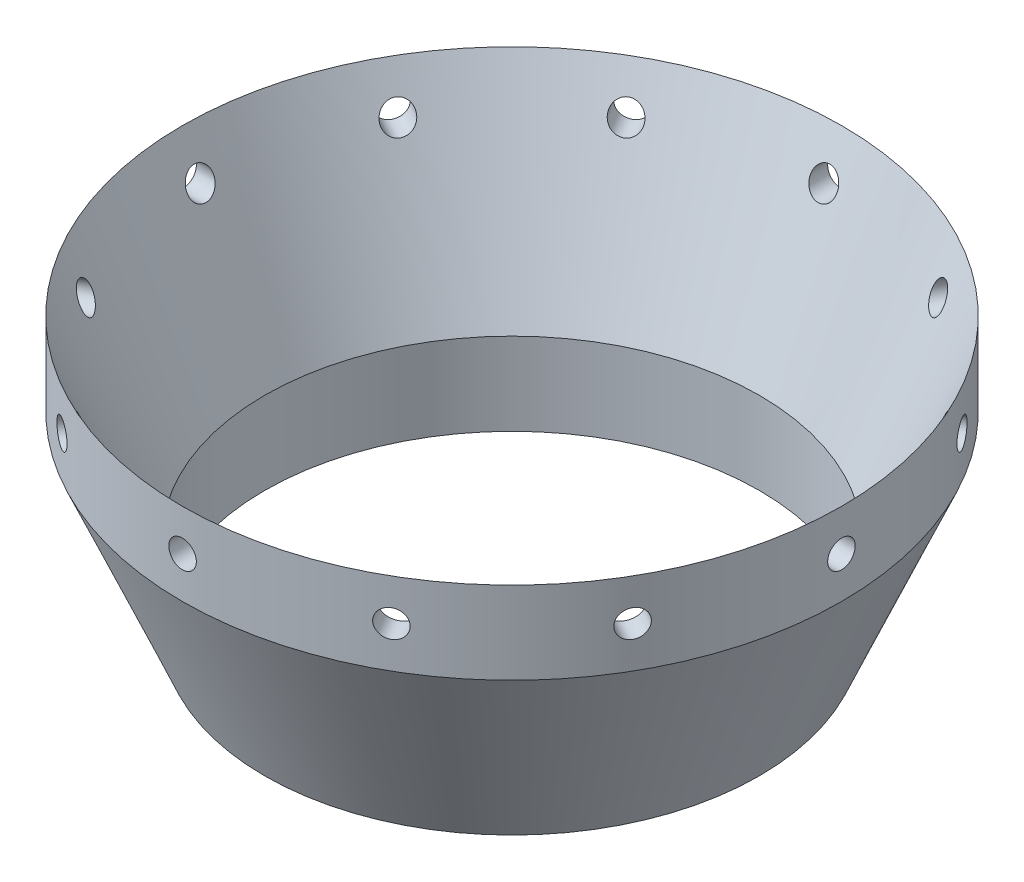
from build123d import *

# Parameters (mm, degrees)
SKETCH2_R          = 3.175
CUT_EXTRUDE1_DEPTH = 267.514272105
CIRPATTERN1_COUNT  = 12


with BuildPart() as part:
    # Sketch1 → Revolve1 (revolve)
    with BuildSketch(Plane.XY):
        Polygon((-57.15, 180.255978871), (-57.15, 199.305978871), (-76.2, 243.755978871), (-76.2, 224.705978871), align=None)
    revolve(axis=Axis((0, 0, 0), (0, 1, 0)))

    # Sketch2 → Cut-Extrude1 (cut, through all)
    with BuildSketch(Plane.XY):
        with Locations((0, 234.230978871)):
            Circle(SKETCH2_R)
    cut_extrude1 = extrude(amount=-CUT_EXTRUDE1_DEPTH, mode=Mode.SUBTRACT)

    # CirPattern1: Cut-Extrude1 ×12 about axis
    cirpattern1_axis = Axis((0, 235.80346447, 0), (0, -1, 0))
    for i in range(1, CIRPATTERN1_COUNT):
        add(cut_extrude1.rotate(cirpattern1_axis, i * 360 / CIRPATTERN1_COUNT), mode=Mode.SUBTRACT)


solid = part.part
